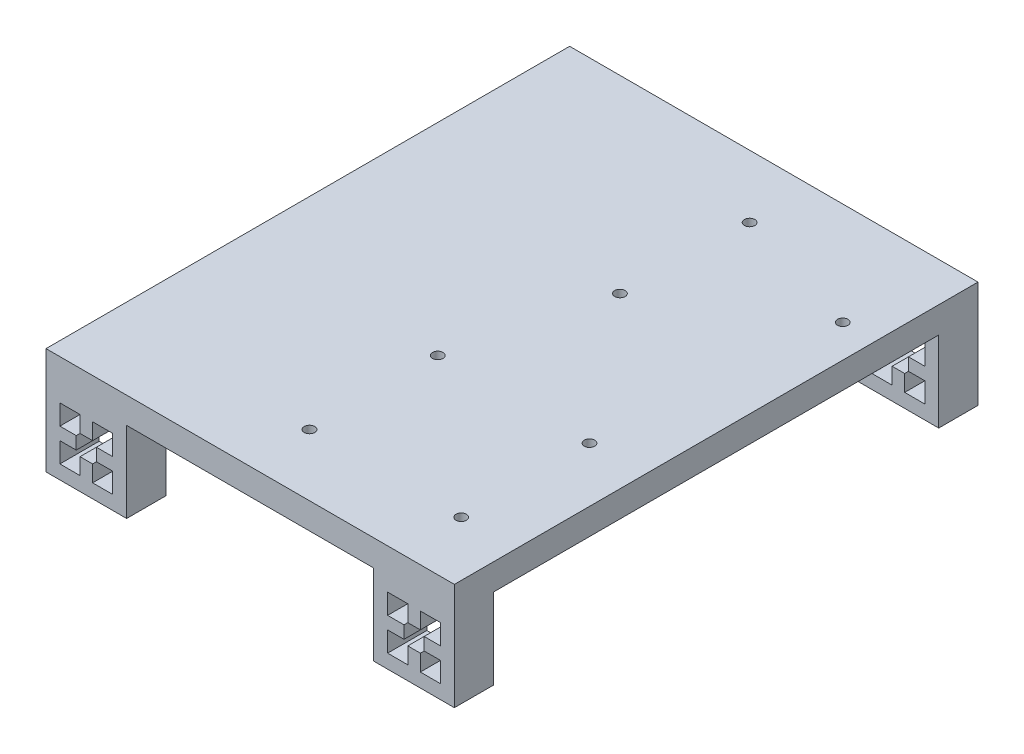
from build123d import *

# Parameters (mm, degrees)
ESQUISSE1_W             = 30.8
ESQUISSE1_H             = 30.8
BOSS_EXTRU_1_DEPTH      = 15
ESQUISSE6_W             = 155.98
ESQUISSE6_H             = 200
BOSS_EXTRU_4_DEPTH      = 10
ESQUISSE16_W            = 30.8
ESQUISSE16_H            = 30.8
BOSS_EXTRU_12_DEPTH     = 15
ESQUISSE25_W            = 30.8
ESQUISSE25_H            = 30.8
BOSS_EXTRU_21_DEPTH     = 15
ESQUISSE26_W            = 30.8
ESQUISSE26_H            = 30.8
BOSS_EXTRU_22_DEPTH     = 15
ESQUISSE27_R            = 2
ENL_V_MAT_EXTRU_1_DEPTH = 10
ESQUISSE28_R            = 2
ENL_V_MAT_EXTRU_2_DEPTH = 10
ESQUISSE29_R            = 2
ENL_V_MAT_EXTRU_3_DEPTH = 10
CHANFREIN1_SIZE         = 3
CHANFREIN2_SIZE         = 3
CHANFREIN3_SIZE         = 3
ESQUISSE30_R            = 2
ENL_V_MAT_EXTRU_4_DEPTH = 10
CHANFREIN4_SIZE         = 3


with BuildPart() as part:
    # Esquisse1 → Boss.-Extru.1 (new body)
    with BuildSketch(Plane.XY):
        with Locations((-26.267627057, 8.434243976)):
            Rectangle(ESQUISSE1_W, ESQUISSE1_H)
        Polygon((-30.117627057, 6.034243976), (-30.117627057, 10.834243976), (-36.367627057, 10.834243976), (-36.367627057, 18.534243976), (-28.667627057, 18.534243976), (-28.667627057, 12.284243976), (-23.867627057, 12.284243976), (-23.867627057, 18.534243976), (-16.177627057, 18.534243976), (-16.177627057, 10.834243976), (-22.427627057, 10.834243976), (-22.427627057, 6.034243976), (-16.177627057, 6.034243976), (-16.177627057, -1.665756024), (-23.867627057, -1.665756024), (-23.867627057, 4.584243976), (-28.667627057, 4.584243976), (-28.667627057, -1.665756024), (-36.367627057, -1.665756024), (-36.367627057, 6.034243976), align=None, mode=Mode.SUBTRACT)
    extrude(amount=BOSS_EXTRU_1_DEPTH)

    # Esquisse6 → Boss.-Extru.4 (add)
    with BuildSketch(Plane(origin=(0, 23.834243976, 0), x_dir=(1, 0, 0), z_dir=(0, 1, 0))):
        with Locations((36.322372943, 85)):
            Rectangle(ESQUISSE6_W, ESQUISSE6_H)
    extrude(amount=BOSS_EXTRU_4_DEPTH)

    # Esquisse16 → Boss.-Extru.12 (add)
    with BuildSketch(Plane.XY.offset(15)):
        with Locations((98.912372943, 8.434243976)):
            Rectangle(ESQUISSE16_W, ESQUISSE16_H)
        Polygon((95.062372943, 6.034243976), (95.062372943, 10.834243976), (88.812372943, 10.834243976), (88.812372943, 18.534243976), (96.512372943, 18.534243976), (96.512372943, 12.284243976), (101.312372943, 12.284243976), (101.312372943, 18.534243976), (109.002372943, 18.534243976), (109.002372943, 10.834243976), (102.752372943, 10.834243976), (102.752372943, 6.034243976), (109.002372943, 6.034243976), (109.002372943, -1.665756024), (101.312372943, -1.665756024), (101.312372943, 4.584243976), (96.512372943, 4.584243976), (96.512372943, -1.665756024), (88.812372943, -1.665756024), (88.812372943, 6.034243976), align=None, mode=Mode.SUBTRACT)
    extrude(amount=-BOSS_EXTRU_12_DEPTH)

    # Esquisse25 → Boss.-Extru.21 (add)
    with BuildSketch(Plane(origin=(0, 0, -185), x_dir=(-1, 0, 0), z_dir=(0, 0, -1))):
        with Locations((-98.912372943, 8.434243976)):
            Rectangle(ESQUISSE25_W, ESQUISSE25_H)
        Polygon((-102.762372943, 6.034243976), (-102.762372943, 10.834243976), (-109.012372943, 10.834243976), (-109.012372943, 18.534243976), (-101.312372943, 18.534243976), (-101.312372943, 12.284243976), (-96.512372943, 12.284243976), (-96.512372943, 18.534243976), (-88.822372943, 18.534243976), (-88.822372943, 10.834243976), (-95.072372943, 10.834243976), (-95.072372943, 6.034243976), (-88.822372943, 6.034243976), (-88.822372943, -1.665756024), (-96.512372943, -1.665756024), (-96.512372943, 4.584243976), (-101.312372943, 4.584243976), (-101.312372943, -1.665756024), (-109.012372943, -1.665756024), (-109.012372943, 6.034243976), align=None, mode=Mode.SUBTRACT)
    extrude(amount=-BOSS_EXTRU_21_DEPTH)

    # Esquisse26 → Boss.-Extru.22 (add)
    with BuildSketch(Plane(origin=(0, 0, -185), x_dir=(-1, 0, 0), z_dir=(0, 0, -1))):
        with Locations((26.267627057, 8.434243976)):
            Rectangle(ESQUISSE26_W, ESQUISSE26_H)
        Polygon((22.417627057, 6.034243976), (22.417627057, 10.834243976), (16.167627057, 10.834243976), (16.167627057, 18.534243976), (23.867627057, 18.534243976), (23.867627057, 12.284243976), (28.667627057, 12.284243976), (28.667627057, 18.534243976), (36.357627057, 18.534243976), (36.357627057, 10.834243976), (30.107627057, 10.834243976), (30.107627057, 6.034243976), (36.357627057, 6.034243976), (36.357627057, -1.665756024), (28.667627057, -1.665756024), (28.667627057, 4.584243976), (23.867627057, 4.584243976), (23.867627057, -1.665756024), (16.167627057, -1.665756024), (16.167627057, 6.034243976), align=None, mode=Mode.SUBTRACT)
    extrude(amount=-BOSS_EXTRU_22_DEPTH)

    # Esquisse27 → Enlèv. mat.-Extru.1 (cut)
    with BuildSketch(Plane(origin=(0, 33.834243976, 0), x_dir=(1, 0, 0), z_dir=(0, 1, 0))):
        with Locations((101.794675451, 145.849463415)):
            Circle(ESQUISSE27_R)
    extrude(amount=-ENL_V_MAT_EXTRU_1_DEPTH, mode=Mode.SUBTRACT)

    # Esquisse28 → Enlèv. mat.-Extru.2 (cut)
    with BuildSketch(Plane(origin=(0, 33.834243976, 0), x_dir=(1, 0, 0), z_dir=(0, 1, 0))):
        with Locations((50.994675451, 161.089463415)):
            Circle(ESQUISSE28_R)
    extrude(amount=-ENL_V_MAT_EXTRU_2_DEPTH, mode=Mode.SUBTRACT)

    # Esquisse29 → Enlèv. mat.-Extru.3 (cut)
    with BuildSketch(Plane(origin=(0, 33.834243976, 0), x_dir=(1, 0, 0), z_dir=(0, 1, 0))):
        with Locations((49.724675451, 112.829463415)):
            Circle(ESQUISSE29_R)
    extrude(amount=-ENL_V_MAT_EXTRU_3_DEPTH, mode=Mode.SUBTRACT)

    # Chanfrein1
    chanfrein1_edges = [part.edges().sort_by_distance(p)[0] for p in [
        (47.724675451, 23.834243976, -112.829463415),
    ]]
    chamfer(chanfrein1_edges, length=CHANFREIN1_SIZE)

    # Chanfrein2
    chanfrein2_edges = [part.edges().sort_by_distance(p)[0] for p in [
        (48.994675451, 23.834243976, -161.089463415),
    ]]
    chamfer(chanfrein2_edges, length=CHANFREIN2_SIZE)

    # Chanfrein3
    chanfrein3_edges = [part.edges().sort_by_distance(p)[0] for p in [
        (99.794675451, 23.834243976, -145.849463415),
    ]]
    chamfer(chanfrein3_edges, length=CHANFREIN3_SIZE)

    # Esquisse30 → Enlèv. mat.-Extru.4 (cut)
    with BuildSketch(Plane(origin=(0, 33.834243976, 0), x_dir=(1, 0, 0), z_dir=(0, 1, 0))):
        with Locations((93.409060351, 8.501841196)):
            Circle(ESQUISSE30_R)
        with Locations((93.409060351, 57.501841196)):
            Circle(ESQUISSE30_R)
        with Locations((35.40909069, 57.561164843)):
            Circle(ESQUISSE30_R)
        with Locations((35.40909069, 8.561164843)):
            Circle(ESQUISSE30_R)
    extrude(amount=-ENL_V_MAT_EXTRU_4_DEPTH, mode=Mode.SUBTRACT)

    # Chanfrein4
    chanfrein4_edges = [part.edges().sort_by_distance(p)[0] for p in [
        (91.409060351, 23.834243976, -57.501841196),
        (91.409060351, 23.834243976, -8.501841196),
        (33.40909069, 23.834243976, -8.561164843),
        (33.40909069, 23.834243976, -57.561164843),
    ]]
    chamfer(chanfrein4_edges, length=CHANFREIN4_SIZE)


solid = part.part
